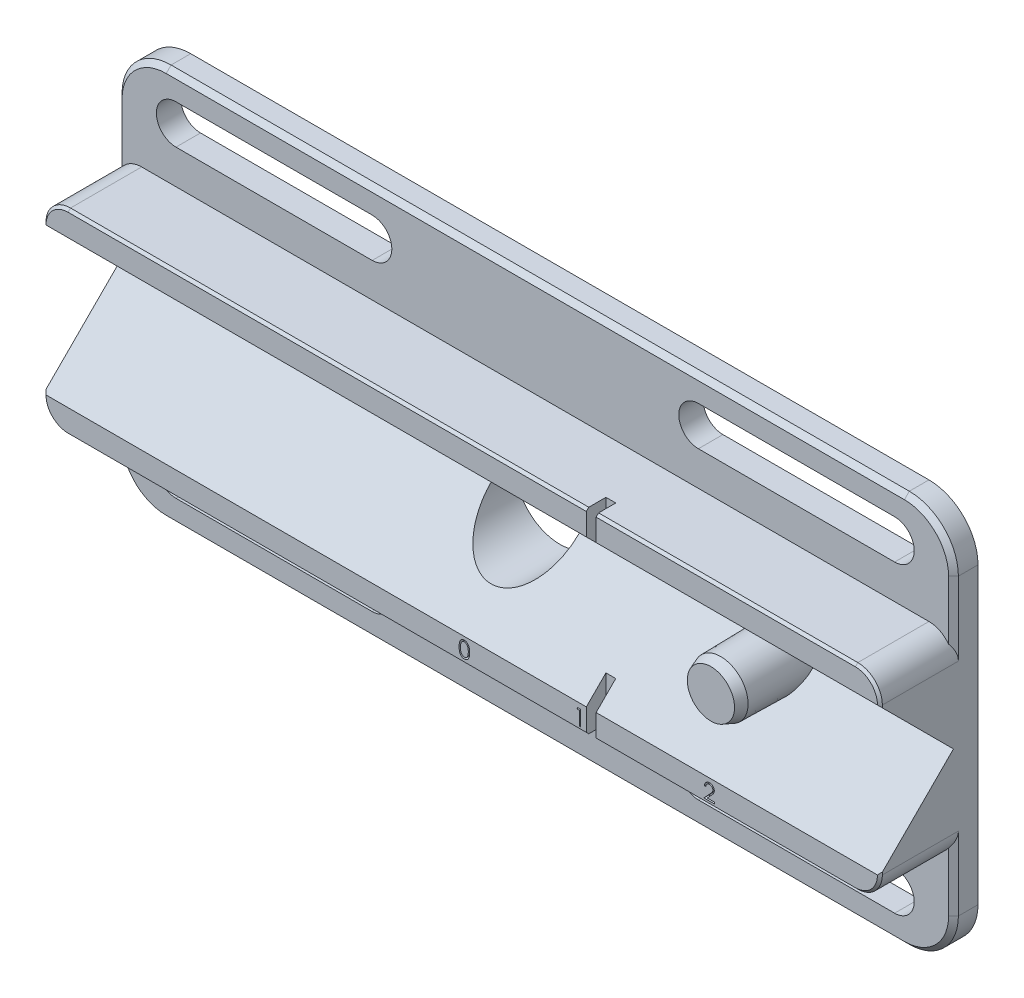
from build123d import *

# Parameters (mm, degrees)
SKETCH3_W           = 170.5
SKETCH3_H           = 40
BOSS_EXTRUDE1_DEPTH = 20
BOSS_EXTRUDE4_DEPTH = 5
CUT_EXTRUDE1_REACH  = 178.268
SKETCH8_R           = 5.9
BOSS_EXTRUDE3_DEPTH = 20
BOSS_EXTRUDE3_TAPER = 1
CHAMFER1_SIZE       = 2
CHAMFER1_SIZE_2     = 0.732706328
FILLET1_R           = 5
SKETCH9_W           = 2
SKETCH9_H           = 40
CUT_EXTRUDE4_DEPTH  = 4
CUT_EXTRUDE5_DEPTH  = 1
SKETCH12_R          = 9
CUT_EXTRUDE6_DEPTH  = 97.268180211
CUT_EXTRUDE7_DEPTH  = 96.354929186
CHAMFER2_SIZE       = 1


with BuildPart() as part:
    # Sketch3 → Boss-Extrude1 (new body)
    with BuildSketch(Plane.XY):
        Rectangle(SKETCH3_W, SKETCH3_H)
    extrude(amount=BOSS_EXTRUDE1_DEPTH)

    # Sketch11 → Boss-Extrude4 (add)
    with BuildSketch(Plane.XY):
        with BuildLine():
            Line((-75.25, 40), (75.25, 40))
            ThreePointArc((75.25, 40), (82.321067812, 37.071067812), (85.25, 30))
            Line((85.25, 30), (85.25, -30))
            ThreePointArc((85.25, -30), (82.321067812, -37.071067812), (75.25, -40))
            Line((75.25, -40), (-75.25, -40))
            ThreePointArc((-75.25, -40), (-82.321067812, -37.071067812), (-85.25, -30))
            Line((-85.25, -30), (-85.25, 30))
            ThreePointArc((-85.25, 30), (-82.321067812, 37.071067812), (-75.25, 40))
        make_face()
    extrude(amount=BOSS_EXTRUDE4_DEPTH)

    # Sketch4 → Cut-Extrude1 (cut, up to next)
    with BuildSketch(Plane(origin=(85.25, 0, 0), x_dir=(0, 0, -1), z_dir=(1, 0, 0)), mode=Mode.PRIVATE) as cut_extrude1_sk1:
        Polygon((-20, 15), (-5, 0), (-20, -15), align=None)
    cut_extrude1_tool1 = extrude(cut_extrude1_sk1.sketch, amount=-CUT_EXTRUDE1_REACH, mode=Mode.PRIVATE) & part.part
    add(cut_extrude1_tool1.solids().sort_by_distance((85.25, 0, 15))[0], mode=Mode.SUBTRACT)

    # Sketch8 → Boss-Extrude3 (add)
    with BuildSketch(Plane.XY):
        with Locations((50.8, 0)):
            Circle(SKETCH8_R)
    extrude(amount=BOSS_EXTRUDE3_DEPTH, taper=BOSS_EXTRUDE3_TAPER)

    # Chamfer1
    # the kernel refuses this chamfer: 2, 0.732706328 mm, written as the material it takes off along each edge
    with BuildSketch(Plane(origin=(50.8, 0, 20), x_dir=(1, 0, 0), z_dir=(0, 1, 0))) as chamfer1_piece_1:
        Polygon((5.550898701 + CHAMFER1_SIZE * 0.0174524064373, CHAMFER1_SIZE * 0.999847695156), (5.550898701 - CHAMFER1_SIZE_2, 0), (5.550898701, 0), align=None)
    revolve(axis=Axis((50.8, 0, 20), (0, 0, -1)), mode=Mode.SUBTRACT)

    # Fillet1
    fillet1_edges = [part.edges().sort_by_distance(p)[0] for p in [
        (-85.25, 20, 12.5),
        (-85.25, -20, 12.5),
        (85.25, 20, 12.5),
        (85.25, -20, 12.5),
    ]]
    fillet(fillet1_edges, radius=FILLET1_R)

    # Sketch9 → Cut-Extrude4 (cut)
    with BuildSketch(Plane.XY.offset(20)):
        with Locations((26.4, 0)):
            Rectangle(SKETCH9_W, SKETCH9_H)
    extrude(amount=-CUT_EXTRUDE4_DEPTH, mode=Mode.SUBTRACT)

    # Sketch10 → Cut-Extrude5 (cut)
    # profile 1 of 3: a face of its own
    with BuildSketch(Plane.XY.offset(20)):
        with BuildLine():
            add(Edge.make_bspline(
                [(-0.53113136, -17.318715202), (-0.5308338, -17.267826857), (-0.530255787, -17.168975515), (-0.523825577, -17.024935161), (-0.513143659, -16.889806898), (-0.498504756, -16.76358426), (-0.480690303, -16.646234659), (-0.456909111, -16.538071701), (-0.42986464, -16.438594772), (-0.398520636, -16.347479485), (-0.363153142, -16.263498283), (-0.324659205, -16.185098279), (-0.281511142, -16.112398098), (-0.236174942, -16.044237388), (-0.18681542, -15.981731893), (-0.134837232, -15.923998907), (-0.078211672, -15.872372726), (-0.018863658, -15.825340723), (0.043744135, -15.784111559), (0.107827125, -15.747796147), (0.1738264, -15.716771981), (0.241922151, -15.692378514), (0.311502329, -15.672230103), (0.382810168, -15.658451558), (0.455963405, -15.649782077), (0.505340492, -15.64895325), (0.530382062, -15.64853291)],
                knots=[0, 0, 0, 0, 1.646270934, 3.197905019, 4.663502075, 6.030701355, 7.308322542, 8.50163776, 9.611534131, 10.641858119, 11.616356847, 12.558055219, 13.465016945, 14.349605745, 15.204443733, 16.039544428, 16.859896111, 17.680448484, 18.487036065, 19.28249412, 20.06191084, 20.843045899, 21.620316918, 22.403196591, 23.190181807, 24, 24, 24, 24], degree=3))
            add(Edge.make_bspline(
                [(0.530382062, -15.64853291), (0.555632817, -15.648975428), (0.605848625, -15.649855458), (0.680089537, -15.658313605), (0.75261532, -15.672348124), (0.823116774, -15.69223358), (0.892173012, -15.716903944), (0.959243896, -15.747825828), (1.024746035, -15.783820229), (1.08763851, -15.826114747), (1.148611768, -15.873270097), (1.206168134, -15.926576233), (1.260312848, -15.985494906), (1.311725446, -16.04939574), (1.35894731, -16.119504353), (1.403917494, -16.194601367), (1.44416927, -16.27600008), (1.482935725, -16.362342361), (1.516397492, -16.456017252), (1.546574729, -16.556496713), (1.570957793, -16.664967583), (1.591268061, -16.780860748), (1.60700236, -16.904601822), (1.618461971, -17.035925551), (1.624515412, -17.174918334), (1.62565542, -17.269948669), (1.626240435, -17.318715202)],
                knots=[0, 0, 0, 0, 0.810914788, 1.612654377, 2.396697861, 3.181598691, 3.963628158, 4.749916497, 5.551656086, 6.361998678, 7.18212741, 8.025565596, 8.878627764, 9.750805457, 10.657531673, 11.591944965, 12.560506719, 13.57287815, 14.630710178, 15.753379473, 16.941251878, 18.199788006, 19.531962791, 20.947069417, 22.433333509, 24, 24, 24, 24], degree=3))
            add(Edge.make_bspline(
                [(1.626240435, -17.318715202), (1.625649355, -17.367269033), (1.624497659, -17.461874192), (1.618529832, -17.600241577), (1.606774503, -17.730868373), (1.592069728, -17.854067864), (1.571703497, -17.969327275), (1.546661668, -18.077045454), (1.518857446, -18.177687576), (1.484535883, -18.270429155), (1.446970453, -18.356563932), (1.406098953, -18.436997702), (1.362311325, -18.512441411), (1.314605821, -18.582291181), (1.263757368, -18.64704182), (1.208677659, -18.705550378), (1.150919343, -18.75922663), (1.089766651, -18.806989178), (1.025893315, -18.848794679), (0.960616153, -18.886181529), (0.892776941, -18.916328331), (0.823913048, -18.94221369), (0.753039459, -18.961989814), (0.680244519, -18.975663954), (0.605898505, -18.985254131), (0.555641371, -18.985985724), (0.530382062, -18.986353423)],
                knots=[0, 0, 0, 0, 1.561518951, 3.042555995, 4.452378317, 5.7783523, 7.031515105, 8.214008947, 9.334062868, 10.386615937, 11.391082383, 12.354592575, 13.286541444, 14.194233754, 15.072674879, 15.931287219, 16.775624067, 17.606195743, 18.42308326, 19.229000347, 20.022332153, 20.807536673, 21.593273796, 22.3848459, 23.188221202, 24, 24, 24, 24], degree=3))
            add(Edge.make_bspline(
                [(0.530382062, -18.986353423), (0.505341187, -18.985930372), (0.45596547, -18.985096198), (0.382802198, -18.976465884), (0.311788839, -18.962590678), (0.242574969, -18.943162759), (0.174805487, -18.919382157), (0.109403856, -18.888399887), (0.045642886, -18.852718267), (-0.016307312, -18.812082421), (-0.075282629, -18.765526322), (-0.131614935, -18.714033003), (-0.18388906, -18.65631748), (-0.232542847, -18.593291079), (-0.278783627, -18.525533637), (-0.321318987, -18.452120042), (-0.360662547, -18.373341388), (-0.396624857, -18.288688712), (-0.428509716, -18.196926742), (-0.456674422, -18.097005701), (-0.478912265, -17.98804366), (-0.497946803, -17.870915762), (-0.513299636, -17.745118697), (-0.52378106, -17.61058417), (-0.530259253, -17.467396016), (-0.530835353, -17.369179863), (-0.53113136, -17.318715202)],
                knots=[0, 0, 0, 0, 0.810891512, 1.598919785, 2.382837074, 3.152667961, 3.926044502, 4.706494248, 5.493654104, 6.291793342, 7.103789334, 7.925228297, 8.761435821, 9.622817696, 10.50288917, 11.416980706, 12.369136599, 13.353924996, 14.394355917, 15.514179734, 16.714354668, 17.994756427, 19.357759367, 20.818452758, 22.365282078, 24, 24, 24, 24], degree=3))
        make_face()
        with BuildLine():
            add(Edge.make_bspline(
                [(-0.246195462, -17.317443167), (-0.246087107, -17.359850915), (-0.24587681, -17.442156027), (-0.240382971, -17.561756699), (-0.232898832, -17.673308355), (-0.223245655, -17.776952634), (-0.208910123, -17.872338717), (-0.192847537, -17.960122644), (-0.173300341, -18.039839852), (-0.150172718, -18.112037366), (-0.123830109, -18.177940449), (-0.095068361, -18.239264409), (-0.064170419, -18.296733665), (-0.029590904, -18.34983201), (0.008069189, -18.398732602), (0.047959217, -18.444300957), (0.091567918, -18.484938219), (0.151896313, -18.533676151), (0.231540258, -18.584039937), (0.331888814, -18.627896747), (0.435002337, -18.655457975), (0.504989543, -18.658962954), (0.539922326, -18.660712397)],
                knots=[0, 0, 0, 0, 1.459021318, 2.831673884, 4.118529203, 5.306027144, 6.411944654, 7.436330062, 8.375795394, 9.233974572, 10.042671642, 10.816086306, 11.563610507, 12.285937304, 12.993564865, 13.685989202, 14.367179055, 15.041617293, 16.353048772, 17.594441528, 18.799311195, 20, 20, 20, 20], degree=3))
            add(Edge.make_bspline(
                [(0.539922326, -18.660712397), (0.575081071, -18.659262982), (0.645325972, -18.656367144), (0.747954486, -18.628428289), (0.847586231, -18.586273778), (0.925665777, -18.536428541), (0.985067798, -18.488959271), (1.027628211, -18.448487411), (1.06669164, -18.403170303), (1.103741237, -18.354275942), (1.13772197, -18.300870188), (1.168622102, -18.243209852), (1.196819139, -18.181134812), (1.212883773, -18.137800835), (1.221097206, -18.11564529)],
                knots=[0, 0, 0, 0, 1.353760809, 2.704726607, 4.075137775, 5.516104923, 6.260822281, 7.007110065, 7.778089737, 8.566572457, 9.372053459, 10.217411131, 11.088608312, 12, 12, 12, 12], degree=3))
            add(Edge.make_bspline(
                [(1.221097206, -18.11564529), (1.230669167, -18.087315455), (1.250104352, -18.02979374), (1.275152176, -17.940563856), (1.29487836, -17.846944206), (1.312625127, -17.749494278), (1.324738256, -17.647495407), (1.334488059, -17.541263187), (1.340230896, -17.430717523), (1.340942777, -17.355610638), (1.341304538, -17.317443167)],
                knots=[0, 0, 0, 0, 0.884706709, 1.796334032, 2.740027952, 3.714592787, 4.726048262, 5.777819803, 6.87074269, 8, 8, 8, 8], degree=3))
            add(Edge.make_bspline(
                [(1.341304538, -17.317443167), (1.340805438, -17.279281869), (1.339829091, -17.204630212), (1.336097116, -17.095303005), (1.326460017, -16.991464394), (1.31575653, -16.892667036), (1.299974765, -16.799457833), (1.282958755, -16.711056485), (1.260097655, -16.628558169), (1.235677574, -16.550671263), (1.207728143, -16.478280669), (1.176961727, -16.411048878), (1.144103418, -16.348651306), (1.108414385, -16.291259152), (1.070318301, -16.238615345), (1.028809667, -16.191775391), (0.985534986, -16.14928757), (0.924922253, -16.100789383), (0.845570576, -16.051339487), (0.746832025, -16.005831977), (0.644079369, -15.97969874), (0.574616307, -15.976014209), (0.539922326, -15.974173936)],
                knots=[0, 0, 0, 0, 1.31362396, 2.569729283, 3.763502607, 4.902122613, 5.988968491, 7.01645872, 7.998833611, 8.933434873, 9.825090667, 10.667526885, 11.477055099, 12.250526234, 12.991942729, 13.710640831, 14.402115721, 15.076753259, 16.378508321, 17.609869233, 18.806226677, 20, 20, 20, 20], degree=3))
            add(Edge.make_bspline(
                [(0.539922326, -15.974173936), (0.504806289, -15.976016748), (0.434510242, -15.97970573), (0.330689597, -16.00573461), (0.231172078, -16.051103515), (0.152030237, -16.100953167), (0.091375231, -16.148431492), (0.048664502, -16.18960349), (0.008617617, -16.234639735), (-0.028273797, -16.283990044), (-0.062826218, -16.337026484), (-0.094558994, -16.394166292), (-0.123149714, -16.455699029), (-0.149533543, -16.52157251), (-0.172731715, -16.593763795), (-0.191866953, -16.673382811), (-0.209544494, -16.760887527), (-0.222058774, -16.856790224), (-0.233183753, -16.960460463), (-0.240333261, -17.072290601), (-0.245895187, -17.192091861), (-0.246093366, -17.274822526), (-0.246195462, -17.317443167)],
                knots=[0, 0, 0, 0, 1.207732386, 2.417664972, 3.655092373, 4.956220595, 5.625982001, 6.301752483, 6.994047911, 7.697131622, 8.419323945, 9.170223765, 9.943494443, 10.752040957, 11.610060368, 12.549350801, 13.567764191, 14.679664412, 15.874934091, 17.154273443, 18.533957287, 20, 20, 20, 20], degree=3))
        make_face(mode=Mode.SUBTRACT)
    # profile 2 of 3: a face of its own
    with BuildSketch(Plane.XY.offset(20)):
        Polygon((23.666392373, -16.000729029), (24.253436644, -16.000729029), (24.253436644, -19.175729029), (23.968500746, -19.175729029), (23.968500746, -16.326370055), (23.480039208, -16.326370055), align=None)
    # profile 3 of 3: a face of its own
    with BuildSketch(Plane.XY.offset(20)):
        with BuildLine():
            Line((49.780378961, -16.888026228), (49.495443063, -16.888026228))
            add(Edge.make_bspline(
                [(49.495443063, -16.888026228), (49.497300124, -16.85022478), (49.500947341, -16.775983741), (49.518027289, -16.667739912), (49.542466513, -16.564275916), (49.577020903, -16.466422494), (49.619934455, -16.373314433), (49.671396695, -16.285321562), (49.732351116, -16.202779555), (49.801481511, -16.126453604), (49.87656449, -16.056433451), (49.957577735, -15.995967623), (50.042708582, -15.94487945), (50.131698751, -15.902170038), (50.225552262, -15.870111749), (50.323417426, -15.846324976), (50.425724214, -15.832013577), (50.495429091, -15.830475257), (50.530879762, -15.829692895)],
                knots=[0, 0, 0, 0, 1.10065271, 2.161652631, 3.183658789, 4.190468796, 5.17591951, 6.163126047, 7.15150782, 8.156236427, 9.156009102, 10.134482811, 11.092018607, 12.041330605, 13.001268258, 13.972401359, 14.968799086, 16, 16, 16, 16], degree=3))
            add(Edge.make_bspline(
                [(50.530879762, -15.829692895), (50.565694158, -15.830507923), (50.634103202, -15.832109425), (50.733945172, -15.845862644), (50.828993147, -15.867403288), (50.919061335, -15.89762513), (51.003431122, -15.938251003), (51.082736312, -15.987053056), (51.157921048, -16.043495332), (51.225600059, -16.109947005), (51.287746673, -16.18088774), (51.341360862, -16.256623195), (51.387274232, -16.334845476), (51.425544484, -16.416151059), (51.453716839, -16.501305492), (51.475105642, -16.589069026), (51.48719551, -16.680350104), (51.489051001, -16.74213248), (51.489994346, -16.773543055)],
                knots=[0, 0, 0, 0, 1.111607364, 2.184268762, 3.212621178, 4.221274766, 5.211760367, 6.196651075, 7.1921475, 8.207485113, 9.220403448, 10.201281604, 11.166441695, 12.114753415, 13.065576456, 14.026450734, 14.996634279, 16, 16, 16, 16], degree=3))
            add(Edge.make_bspline(
                [(51.489994346, -16.773543055), (51.488458314, -16.817764305), (51.485413207, -16.905430784), (51.459365165, -17.034258553), (51.418682973, -17.15907544), (51.369699656, -17.259529993), (51.320285368, -17.340477519), (51.275755986, -17.40712413), (51.223627193, -17.478884091), (51.16314027, -17.555517104), (51.09554645, -17.637623425), (51.020233488, -17.725153453), (50.936664329, -17.817202845), (50.878009832, -17.880072926), (50.847616541, -17.912650627)],
                knots=[0, 0, 0, 0, 1.184426356, 2.348067706, 3.509069118, 4.696110526, 5.333549288, 6.050745305, 6.844228056, 7.710549037, 8.667450064, 9.695053472, 10.805634456, 12, 12, 12, 12], degree=3))
            Line((50.847616541, -17.912650627), (50.053230523, -18.760462125))
            Line((50.053230523, -18.760462125), (51.530699474, -18.760462125))
            Line((51.530699474, -18.760462125), (51.530699474, -19.086103151))
            Line((51.530699474, -19.086103151), (49.373327679, -19.086103151))
            Line((49.373327679, -19.086103151), (50.604657807, -17.772090731))
            add(Edge.make_bspline(
                [(50.604657807, -17.772090731), (50.634636962, -17.740795839), (50.692220782, -17.680684755), (50.773666405, -17.59292507), (50.846817487, -17.511509415), (50.912147551, -17.436591618), (50.968239374, -17.367075838), (51.018016327, -17.3052135), (51.057899399, -17.248286249), (51.101184079, -17.18230012), (51.143106762, -17.101734661), (51.179131542, -17.0032791), (51.201097869, -16.901926521), (51.20373297, -16.833435387), (51.205058448, -16.79898376)],
                knots=[0, 0, 0, 0, 1.329631726, 2.553950428, 3.673215718, 4.687767853, 5.603093632, 6.413772471, 7.123043292, 7.734684054, 8.834405432, 9.900288307, 10.943827018, 12, 12, 12, 12], degree=3))
            add(Edge.make_bspline(
                [(51.205058448, -16.79898376), (51.204481739, -16.77731992), (51.203345156, -16.734624651), (51.193314245, -16.67202657), (51.178155429, -16.611642775), (51.156433659, -16.553287527), (51.12776183, -16.497547543), (51.092860979, -16.444354972), (51.05259285, -16.392929982), (51.006009912, -16.344712347), (50.954836605, -16.300551539), (50.900776107, -16.261431833), (50.843580656, -16.228739211), (50.783491402, -16.201939039), (50.720675869, -16.180915657), (50.655012564, -16.166348232), (50.586682921, -16.157201978), (50.540025393, -16.15596448), (50.516251357, -16.15533392)],
                knots=[0, 0, 0, 0, 0.991446411, 1.95395049, 2.89581595, 3.838931463, 4.798493298, 5.75982156, 6.748411868, 7.785213223, 8.824556874, 9.840280684, 10.836137867, 11.835679398, 12.848801643, 13.863922112, 14.911575587, 16, 16, 16, 16], degree=3))
            add(Edge.make_bspline(
                [(50.516251357, -16.15533392), (50.491422101, -16.155982557), (50.442661543, -16.157256371), (50.371070706, -16.166166931), (50.302775751, -16.181539229), (50.237604882, -16.202563784), (50.175447829, -16.229286896), (50.116606875, -16.26257155), (50.061214111, -16.302289433), (50.009165408, -16.347320509), (49.961210227, -16.397456119), (49.919076275, -16.453345157), (49.882260776, -16.513967169), (49.850139543, -16.579158583), (49.824054024, -16.64951094), (49.804121238, -16.724774501), (49.788348884, -16.804622469), (49.783079726, -16.859763224), (49.780378961, -16.888026228)],
                knots=[0, 0, 0, 0, 1.031018746, 2.02475058, 2.990194455, 3.934040569, 4.864654155, 5.795059489, 6.735614925, 7.690564532, 8.649604399, 9.611025574, 10.590972636, 11.591080095, 12.624614302, 13.701020113, 14.821632451, 16, 16, 16, 16], degree=3))
        make_face()
    extrude(amount=-CUT_EXTRUDE5_DEPTH, mode=Mode.SUBTRACT)

    # Sketch12 → Cut-Extrude6 (cut, through all)
    with BuildSketch(Plane(origin=(0, 0, 0), x_dir=(-1, 0, 0), z_dir=(0, 0, -1))):
        Circle(SKETCH12_R)
    extrude(amount=-CUT_EXTRUDE6_DEPTH, mode=Mode.SUBTRACT)

    # Sketch13 → Cut-Extrude7 (cut, through all)
    with BuildSketch(Plane.XY.offset(5)):
        with BuildLine():
            Line((-73.25, 35), (-33.25, 35))
            ThreePointArc((-33.25, 35), (-29.25, 31), (-33.25, 27))
            Line((-33.25, 27), (-73.25, 27))
            ThreePointArc((-73.25, 27), (-77.25, 31), (-73.25, 35))
        make_face()
        with BuildLine():
            Line((73.25, 35), (33.25, 35))
            ThreePointArc((33.25, 35), (29.25, 31), (33.25, 27))
            Line((33.25, 27), (73.25, 27))
            ThreePointArc((73.25, 27), (77.25, 31), (73.25, 35))
        make_face()
        with BuildLine():
            Line((73.25, -35), (33.25, -35))
            ThreePointArc((33.25, -35), (29.25, -31), (33.25, -27))
            Line((33.25, -27), (73.25, -27))
            ThreePointArc((73.25, -27), (77.25, -31), (73.25, -35))
        make_face()
        with BuildLine():
            Line((-73.25, -35), (-33.25, -35))
            ThreePointArc((-33.25, -35), (-29.25, -31), (-33.25, -27))
            Line((-33.25, -27), (-73.25, -27))
            ThreePointArc((-73.25, -27), (-77.25, -31), (-73.25, -35))
        make_face()
    extrude(amount=-CUT_EXTRUDE7_DEPTH, mode=Mode.SUBTRACT)

    # Chamfer2
    chamfer2_edges = [part.edges().sort_by_distance(p)[0] for p in [
        (-85.25, -22.5, 5),
        (-82.321067812, -37.071067812, 5),
        (0, -40, 5),
        (82.321067812, -37.071067812, 5),
        (85.25, -22.5, 5),
        (85.25, 22.5, 5),
        (82.321067812, 37.071067812, 5),
        (0, 40, 5),
        (-82.321067812, 37.071067812, 5),
        (-85.25, 22.5, 5),
    ]]
    chamfer(chamfer2_edges, length=CHAMFER2_SIZE)

    # Chamfer3
    # the kernel refuses this chamfer: 0.5 mm, written as the material it takes off along each edge
    with BuildSketch(Plane(origin=(80.25, -20, 20), x_dir=(0, -0.1723873716952951, -0.9850292351397436), z_dir=(-1, 0, 0)), Plane(origin=(25.861807032, 20, 20), x_dir=(0, 0.1723873716952951, -0.9850292351397436), z_dir=(1, 0, 0))) as chamfer3_piece_1:
        with BuildLine():
            Line((0.615277187, 0), (-0.208956256, -0.578708303))
            Line((-0.208956256, -0.578708303), (-0.282833448, -0.565779251))
            ThreePointArc((-0.282833448, -0.565779251), (-0.126116257, -0.28556732), (-0.073877193, 0.012929053))
            Line((-0.073877193, 0.012929053), (0.012929053, 0.073877193))
            ThreePointArc((0.012929053, 0.073877193), (0.311425426, 0.021638129), (0.62820624, 0.073877193))
            Line((0.62820624, 0.073877193), (0.615277187, 0))
        make_face()
    extrude(amount=54.388192968, mode=Mode.SUBTRACT)
    with BuildSketch(Plane(origin=(-80.25, 20, 20), x_dir=(0, 0.1723873716952951, -0.9850292351397436), z_dir=(1, 0, 0)), Plane(origin=(26.938192968, -20, 20), x_dir=(0, -0.1723873716952951, -0.9850292351397436), z_dir=(-1, 0, 0))) as chamfer3_piece_2:
        with BuildLine():
            Line((0.615277187, 0), (-0.208956256, -0.578708303))
            Line((-0.208956256, -0.578708303), (-0.282833448, -0.565779251))
            ThreePointArc((-0.282833448, -0.565779251), (-0.126116257, -0.28556732), (-0.073877193, 0.012929053))
            Line((-0.073877193, 0.012929053), (0.012929053, 0.073877193))
            ThreePointArc((0.012929053, 0.073877193), (0.311425426, 0.021638129), (0.62820624, 0.073877193))
            Line((0.62820624, 0.073877193), (0.615277187, 0))
        make_face()
    extrude(amount=107.188192968, mode=Mode.SUBTRACT)
    with BuildSketch(Plane(origin=(80.25, 15, 20), x_dir=(0.9530138527139119, -0.3029267180943042, 0), z_dir=(-0.3029267180943042, -0.9530138527139119, 0))) as chamfer3_piece_3:
        with BuildLine():
            Line((4.393933983, 0.106066017), (5.106066017, -0.606066017))
            Line((5.106066017, -0.606066017), (5.181066017, -0.606066017))
            ThreePointArc((5.181066017, -0.606066017), (5.075, -0.303033009), (5.075, 0))
            Line((5.075, 0), (5, 0.075))
            ThreePointArc((5, 0.075), (4.696966991, 0.075), (4.393933983, 0.181066017))
            Line((4.393933983, 0.181066017), (4.393933983, 0.106066017))
        make_face()
    revolve(axis=Axis((80.25, 15, 20), (0, 0, 1)), revolution_arc=107.633473697, mode=Mode.SUBTRACT)
    with BuildSketch(Plane(origin=(-80.25, 15, 20), x_dir=(-0.9530138527139119, -0.3029267180943042, 0), z_dir=(0.3029267180943042, -0.9530138527139119, 0))) as chamfer3_piece_4:
        with BuildLine():
            Line((4.393933983, -0.106066017), (5.106066017, 0.606066017))
            Line((5.106066017, 0.606066017), (5.181066017, 0.606066017))
            ThreePointArc((5.181066017, 0.606066017), (5.075, 0.303033009), (5.075, 0))
            Line((5.075, 0), (5, -0.075))
            ThreePointArc((5, -0.075), (4.696966991, -0.075), (4.393933983, -0.181066017))
            Line((4.393933983, -0.181066017), (4.393933983, -0.106066017))
        make_face()
    revolve(axis=Axis((-80.25, 15, 20), (0, 0, -1)), revolution_arc=107.633473697, mode=Mode.SUBTRACT)
    with BuildSketch(Plane(origin=(80.25, -15, 20), x_dir=(0.9530138527139117, 0.3029267180943049, 0), z_dir=(-0.3029267180943049, 0.9530138527139117, 0))) as chamfer3_piece_5:
        with BuildLine():
            Line((4.393933983, -0.106066017), (5.106066017, 0.606066017))
            Line((5.106066017, 0.606066017), (5.181066017, 0.606066017))
            ThreePointArc((5.181066017, 0.606066017), (5.075, 0.303033009), (5.075, 0))
            Line((5.075, 0), (5, -0.075))
            ThreePointArc((5, -0.075), (4.696966991, -0.075), (4.393933983, -0.181066017))
            Line((4.393933983, -0.181066017), (4.393933983, -0.106066017))
        make_face()
    revolve(axis=Axis((80.25, -15, 20), (0, 0, -1)), revolution_arc=107.633473697, mode=Mode.SUBTRACT)
    with BuildSketch(Plane(origin=(-80.25, -15, 20), x_dir=(-0.9530138527139117, 0.3029267180943049, 0), z_dir=(0.3029267180943049, 0.9530138527139117, 0))) as chamfer3_piece_6:
        with BuildLine():
            Line((4.393933983, 0.106066017), (5.106066017, -0.606066017))
            Line((5.106066017, -0.606066017), (5.181066017, -0.606066017))
            ThreePointArc((5.181066017, -0.606066017), (5.075, -0.303033009), (5.075, 0))
            Line((5.075, 0), (5, 0.075))
            ThreePointArc((5, 0.075), (4.696966991, 0.075), (4.393933983, 0.181066017))
            Line((4.393933983, 0.181066017), (4.393933983, 0.106066017))
        make_face()
    revolve(axis=Axis((-80.25, -15, 20), (0, 0, 1)), revolution_arc=107.633473697, mode=Mode.SUBTRACT)


solid = part.part
